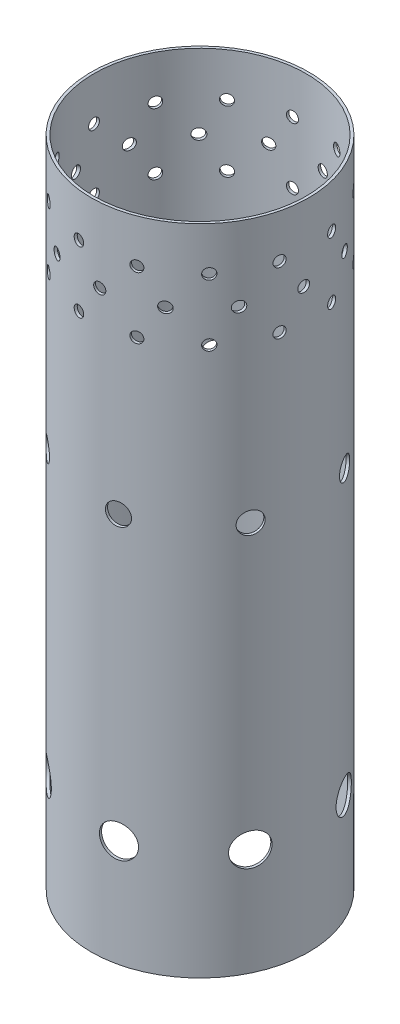
from build123d import *

# Parameters (mm, degrees)
SKETCH2_R           = 63.5
SKETCH2_R_2         = 61.9125
BOSS_EXTRUDE1_DEPTH = 381
SKETCH3_R           = 3.175
CUT_EXTRUDE1_DEPTH  = 381
CIRPATTERN1_COUNT   = 13
SKETCH4_R           = 6.35
SKETCH4_R_2         = 9.525
CUT_EXTRUDE2_DEPTH  = 381
CIRPATTERN2_COUNT   = 7


with BuildPart() as part:
    # Sketch2 → Boss-Extrude1 (new body)
    with BuildSketch(Plane(origin=(0, 0, 0), x_dir=(1, 0, 0), z_dir=(0, 1, 0))):
        Circle(SKETCH2_R)
        Circle(SKETCH2_R_2, mode=Mode.SUBTRACT)
    extrude(amount=BOSS_EXTRUDE1_DEPTH)

    # Sketch3 → Cut-Extrude1 (cut)
    with BuildSketch(Plane(origin=(0, 0, 0), x_dir=(0, 0, -1), z_dir=(1, 0, 0))):
        with Locations((0, 355.6)):
            Circle(SKETCH3_R)
        with Locations((17.960512242, 337.639487758)):
            Circle(SKETCH3_R)
        with Locations((0, 319.678975516)):
            Circle(SKETCH3_R)
    cut_extrude1 = extrude(amount=-CUT_EXTRUDE1_DEPTH, mode=Mode.SUBTRACT)

    # CirPattern1: Cut-Extrude1 ×13 about axis
    cirpattern1_axis = Axis((0, 381, 0), (0, -1, 0))
    for i in range(1, CIRPATTERN1_COUNT):
        add(cut_extrude1.rotate(cirpattern1_axis, i * 360 / CIRPATTERN1_COUNT), mode=Mode.SUBTRACT)

    # Sketch4 → Cut-Extrude2 (cut)
    with BuildSketch(Plane(origin=(0, 0, 0), x_dir=(0, 0, -1), z_dir=(1, 0, 0))):
        with Locations((0, 227.472965379)):
            Circle(SKETCH4_R)
        with Locations((0, 62.372965379)):
            Circle(SKETCH4_R_2)
    cut_extrude2 = extrude(amount=-CUT_EXTRUDE2_DEPTH, mode=Mode.SUBTRACT)

    # CirPattern2: Cut-Extrude2 ×7 about axis
    cirpattern2_axis = Axis((0, 381, 0), (0, -1, 0))
    for i in range(1, CIRPATTERN2_COUNT):
        add(cut_extrude2.rotate(cirpattern2_axis, i * 360 / CIRPATTERN2_COUNT), mode=Mode.SUBTRACT)


solid = part.part
